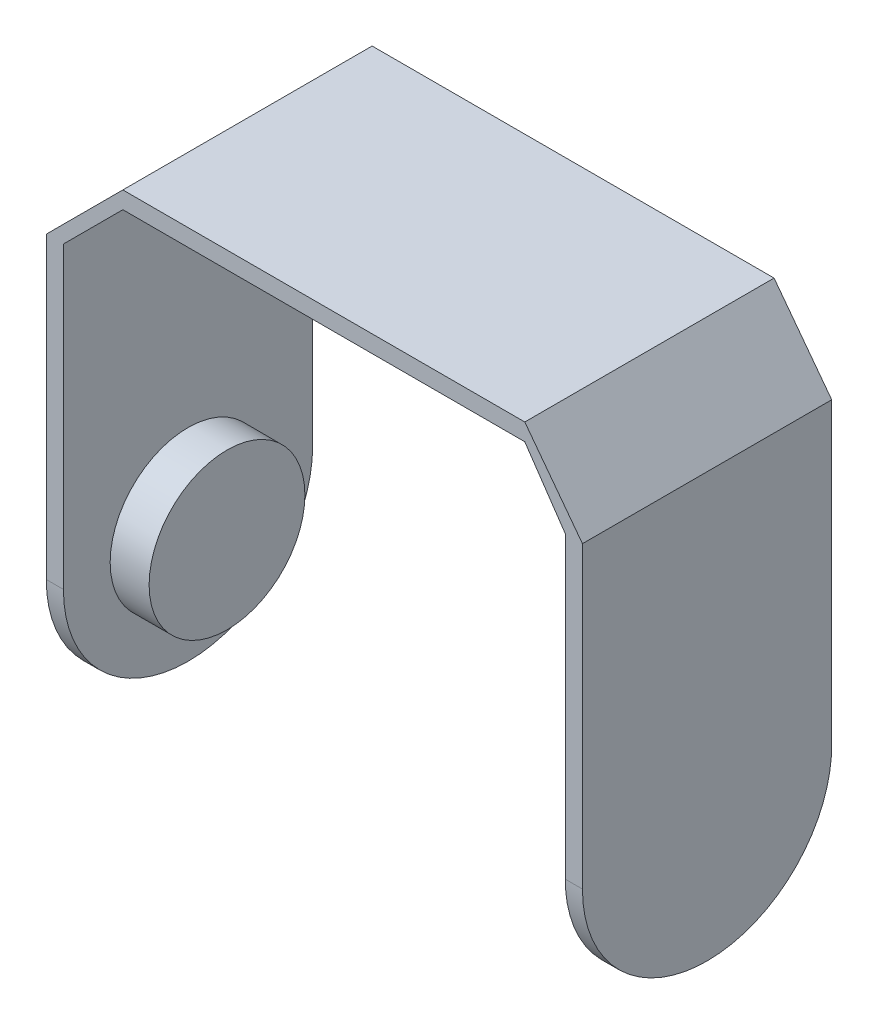
from build123d import *

# Parameters (mm, degrees)
BOSS_EXTRUDE1_DEPTH = 32
FILLET1_R           = 16
FILLET2_R           = 16
SKETCH2_R           = 10
BOSS_EXTRUDE2_DEPTH = 5


with BuildPart() as part:
    # Sketch1 → Boss-Extrude1 (new body)
    with BuildSketch(Plane.XY):
        Polygon((0, 0), (0, 54.4), (-5.201179862, 62.028885271), (-56.801179862, 62.028885271), (-64.430065133, 54.4), (-64.430065133, 0), (-66.630065133, 0), (-66.630065133, 54.4), (-56.801179862, 64.228885271), (-5.201179862, 64.228885271), (2.2, 54.4), (2.2, 0.000275755), align=None)
    extrude(amount=BOSS_EXTRUDE1_DEPTH)

    # Fillet1
    fillet1_edges = [part.edges().sort_by_distance(p)[0] for p in [
        (-65.530065133, 0, 0),
        (-65.530065133, 0, 32),
    ]]
    fillet(fillet1_edges, radius=FILLET1_R - 0.0001)  # a hair under: the kernel refuses the full size

    # Fillet2
    fillet2_edges = [part.edges().sort_by_distance(p)[0] for p in [
        (1.1, 0.000137878, 32),
        (1.1, 0.000137878, 0),
    ]]
    fillet(fillet2_edges, radius=FILLET2_R - 0.0001)  # a hair under: the kernel refuses the full size

    # Sketch2 → Boss-Extrude2 (add)
    with BuildSketch(Plane(origin=(-64.430065133, 0, 0), x_dir=(0, 0, -1), z_dir=(1, 0, 0))):
        with Locations(Location((-16, 16, 0), (0, 0, 180))):
            Circle(SKETCH2_R)
    boss_extrude2 = extrude(amount=BOSS_EXTRUDE2_DEPTH)

    # Mirror1: Boss-Extrude2 across plane
    add(boss_extrude2.mirror(Plane(origin=(-32.215032567, 0, 0), x_dir=(0, 0, 1), z_dir=(1, 0, 0))))


solid = part.part
